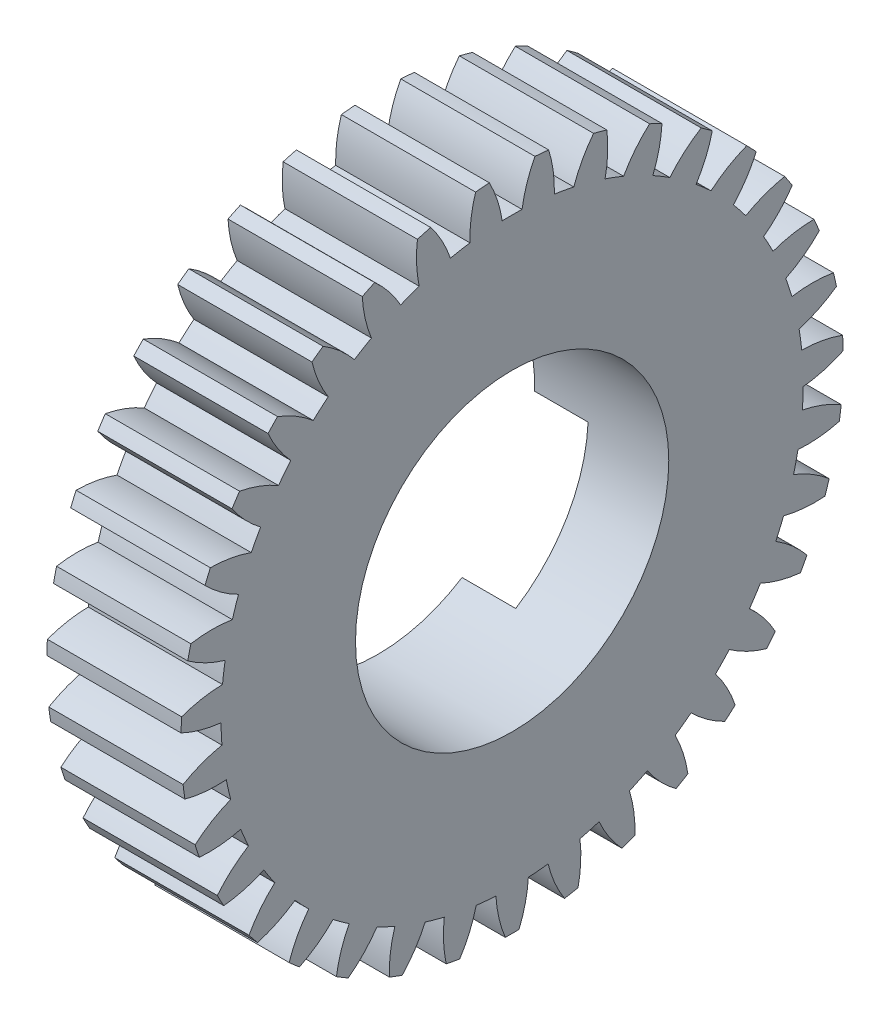
from build123d import *

# Parameters (mm, degrees)
SPUR_START             = -50.197682286
SPUR_GEAR_AI_OUTLINE_R = 11.1125
SPUR_GEAR_AI_DEPTH     = 9.525
CUT_EXTRUDE1_DEPTH     = 3.81
FILLET1_R              = 3.175


# Read off the part's stored shape, not the designer's step: spur gear_ai
with BuildPart() as part:
    # spur gear_ai outline → spur gear_ai (new body)
    with BuildSketch(Plane.YZ.offset(SPUR_START)):
        with BuildLine():
            ThreePointArc((32.465138514, 13.00952455), (32.599496942, 13.477405803), (32.724133068, 13.947970241))
            ThreePointArc((32.724133068, 13.947970241), (31.486680208, 14.75753637), (30.13215139, 15.350780486))
            ThreePointArc((30.13215139, 15.350780486), (30.269532321, 16.0407059), (30.383333924, 16.734910332))
            ThreePointArc((30.383333924, 16.734910332), (31.859942083, 16.814378835), (33.302949758, 17.137513095))
            ThreePointArc((33.302949758, 17.137513095), (33.351605568, 17.621865927), (33.390216215, 18.10712284))
            ThreePointArc((33.390216215, 18.10712284), (32.028096117, 18.682723168), (30.589407307, 19.024573147))
            ThreePointArc((30.589407307, 19.024573147), (30.60138953, 19.72794149), (30.589407307, 20.431309832))
            ThreePointArc((30.589407307, 20.431309832), (32.028096117, 20.773159811), (33.390216215, 21.348760139))
            ThreePointArc((33.390216215, 21.348760139), (33.351605568, 21.834017052), (33.302949758, 22.318369884))
            ThreePointArc((33.302949758, 22.318369884), (31.859942083, 22.641504144), (30.383333924, 22.720972647))
            ThreePointArc((30.383333924, 22.720972647), (30.269532321, 23.415177079), (30.13215139, 24.105102493))
            ThreePointArc((30.13215139, 24.105102493), (31.486680208, 24.698346609), (32.724133068, 25.507912738))
            ThreePointArc((32.724133068, 25.507912738), (32.599496942, 25.978477176), (32.465138514, 26.446358429))
            ThreePointArc((32.465138514, 26.446358429), (30.987622717, 26.506640818), (29.520554609, 26.321173662))
            ThreePointArc((29.520554609, 26.321173662), (29.284626856, 26.983901882), (29.026262754, 27.638209599))
            ThreePointArc((29.026262754, 27.638209599), (30.253095909, 28.463780497), (31.326108778, 29.481292306))
            ThreePointArc((31.326108778, 29.481292306), (31.119453082, 29.92203994), (30.903710425, 30.358411525))
            ThreePointArc((30.903710425, 30.358411525), (29.439175078, 30.153904518), (28.028799798, 29.70946277))
            ThreePointArc((28.028799798, 29.70946277), (27.678328808, 30.319414148), (27.307285569, 30.917074179))
            ThreePointArc((27.307285569, 30.917074179), (28.366991634, 31.948437332), (29.241076997, 33.141191153))
            ThreePointArc((29.241076997, 33.141191153), (28.959043813, 33.537955992), (28.668851074, 33.928792567))
            ThreePointArc((28.668851074, 33.928792567), (27.264367549, 33.466069188), (25.956015718, 32.776937571))
            ThreePointArc((25.956015718, 32.776937571), (25.502265918, 33.314507768), (25.030469177, 33.836310828))
            ThreePointArc((25.030469177, 33.836310828), (25.888988328, 35.040317375), (26.53605236, 36.36997712))
            ThreePointArc((26.53605236, 36.36997712), (26.187706468, 36.710006815), (25.832390681, 37.042746571))
            ThreePointArc((25.832390681, 37.042746571), (24.533100233, 36.33667913), (23.368823357, 35.425006901))
            ThreePointArc((23.368823357, 35.425006901), (22.826378637, 35.872917969), (22.268992329, 36.302092878))
            ThreePointArc((22.268992329, 36.302092878), (22.898731054, 37.640045058), (23.297976586, 39.063874368))
            ThreePointArc((23.297976586, 39.063874368), (22.89451411, 39.336240086), (22.485495416, 39.600188493))
            ThreePointArc((22.485495416, 39.600188493), (21.33315831, 38.673470579), (20.350377203, 37.568559634))
            ThreePointArc((20.350377203, 37.568559634), (19.736672184, 37.912415341), (19.111611165, 38.235168065))
            ThreePointArc((19.111611165, 38.235168065), (19.492329143, 39.664062994), (19.630924094, 41.136298824))
            ThreePointArc((19.630924094, 41.136298824), (19.185312649, 41.332246506), (18.735737246, 41.518920046))
            ThreePointArc((18.735737246, 41.518920046), (17.767390544, 40.401337134), (16.997692602, 39.13870022))
            ThreePointArc((16.997692602, 39.13870022), (16.332452268, 39.367448762), (15.659806512, 39.573405762))
            ThreePointArc((15.659806512, 39.573405762), (15.779267154, 41.047317582), (15.652756969, 42.520641061))
            ThreePointArc((15.652756969, 42.520641061), (15.179318873, 42.633872786), (14.703636484, 42.737271618))
            ThreePointArc((14.703636484, 42.737271618), (13.950403647, 41.464743743), (13.418527594, 40.084963049))
            ThreePointArc((13.418527594, 40.084963049), (12.723133316, 40.19125226), (12.024522212, 40.273793909))
            ThreePointArc((12.024522212, 40.273793909), (11.878885954, 41.745349881), (11.491336775, 43.172407179))
            ThreePointArc((11.491336775, 43.172407179), (11.00528872, 43.199283588), (10.518788168, 43.216084387))
            ThreePointArc((10.518788168, 43.216084387), (10.004878718, 41.829511643), (9.727919488, 40.376934456))
            ThreePointArc((9.727919488, 40.376934456), (9.024721811, 40.357348112), (8.322599294, 40.313821453))
            ThreePointArc((8.322599294, 40.313821453), (7.916547006, 41.735724557), (7.280414982, 43.07064888))
            ThreePointArc((7.280414982, 43.07064888), (6.79737895, 43.010306142), (6.315696764, 42.939968918))
            ThreePointArc((6.315696764, 42.939968918), (6.057628173, 41.483916892), (6.044487465, 40.005230238))
            ThreePointArc((6.044487465, 40.005230238), (5.35608774, 39.860397862), (4.673020606, 39.692201878))
            ThreePointArc((4.673020606, 39.692201878), (4.019603142, 41.018750978), (3.15533408, 42.218636759))
            ThreePointArc((3.15533408, 42.218636759), (2.690835248, 42.07301434), (2.229453088, 41.917799788))
            ThreePointArc((2.229453088, 41.917799788), (2.235519895, 40.439067191), (2.48662006, 38.981797276))
            ThreePointArc((2.48662006, 38.981797276), (1.835144022, 38.716373898), (1.19308661, 38.428914547))
            ThreePointArc((1.19308661, 38.428914547), (0.313305346, 39.617473264), (-0.751322437, 40.643755186))
            ThreePointArc((-0.751322437, 40.643755186), (-1.182354694, 40.41753351), (-1.608607624, 40.182430355))
            ThreePointArc((-1.608607624, 40.182430355), (-1.338600413, 38.72854487), (-0.83132994, 37.339529547))
            ThreePointArc((-0.83132994, 37.339529547), (-1.424943316, 36.962046093), (-2.005354751, 36.564562554))
            ThreePointArc((-2.005354751, 36.564562554), (-3.083222923, 37.576929633), (-4.313991412, 38.396622152))
            ThreePointArc((-4.313991412, 38.396622152), (-4.697703364, 38.09707217), (-5.075126945, 37.789636819))
            ThreePointArc((-5.075126945, 37.789636819), (-4.549857583, 36.407327521), (-3.802720892, 35.131210887))
            ThreePointArc((-3.802720892, 35.131210887), (-4.319392384, 34.653799986), (-4.819502942, 34.159067708))
            ThreePointArc((-4.819502942, 34.159067708), (-6.060814451, 34.962704838), (-7.418165735, 35.54946236))
            ThreePointArc((-7.418165735, 35.54946236), (-7.742224563, 35.186211855), (-8.05868809, 34.816325535))
            ThreePointArc((-8.05868809, 34.816325535), (-7.295039167, 33.550020982), (-6.332049847, 32.427818474))
            ThreePointArc((-6.332049847, 32.427818474), (-6.755173207, 31.865824506), (-7.158908923, 31.28974459))
            ThreePointArc((-7.158908923, 31.28974459), (-8.523766996, 31.858822213), (-9.964074688, 32.19378587))
            ThreePointArc((-9.964074688, 32.19378587), (-10.218064875, 31.778510012), (-10.46339695, 31.358061172))
            ThreePointArc((-10.46339695, 31.358061172), (-9.48591277, 30.248461435), (-8.33802209, 29.316241566))
            ThreePointArc((-8.33802209, 29.316241566), (-8.653997786, 28.687727479), (-8.948382262, 28.048815608))
            ThreePointArc((-8.948382262, 28.048815608), (-10.392919237, 28.3650431), (-11.869890662, 28.437446885))
            ThreePointArc((-11.869890662, 28.437446885), (-12.045648755, 27.983492981), (-12.211964203, 27.525995194))
            ThreePointArc((-12.211964203, 27.525995194), (-11.052061913, 26.608763721), (-9.756164023, 25.896488804))
            ThreePointArc((-9.756164023, 25.896488804), (-9.954836336, 25.221655558), (-10.130407813, 24.540446886))
            ThreePointArc((-10.130407813, 24.540446886), (-11.608195083, 24.593660435), (-13.074359165, 24.40117723))
            ThreePointArc((-13.074359165, 24.40117723), (-13.166236154, 23.923135733), (-13.24818946, 23.443293353))
            ThreePointArc((-13.24818946, 23.443293353), (-11.943149273, 22.747910718), (-10.540895397, 22.278473856))
            ThreePointArc((-10.540895397, 22.278473856), (-10.615878835, 21.579011146), (-10.666994302, 20.87740028))
            ThreePointArc((-10.666994302, 20.87740028), (-12.130534569, 20.665889559), (-13.538767587, 20.214705933))
            ThreePointArc((-13.538767587, 20.214705933), (-13.54381047, 19.72794149), (-13.538767587, 19.241177046))
            ThreePointArc((-13.538767587, 19.241177046), (-12.130534569, 18.78999342), (-10.666994302, 18.578482699))
            ThreePointArc((-10.666994302, 18.578482699), (-10.615878835, 17.876871833), (-10.540895397, 17.177409123))
            ThreePointArc((-10.540895397, 17.177409123), (-11.943149273, 16.707972261), (-13.24818946, 16.012589626))
            ThreePointArc((-13.24818946, 16.012589626), (-13.166236154, 15.532747246), (-13.074359165, 15.054705749))
            ThreePointArc((-13.074359165, 15.054705749), (-11.608195083, 14.862222544), (-10.130407813, 14.915436093))
            ThreePointArc((-10.130407813, 14.915436093), (-9.954836336, 14.234227421), (-9.756164023, 13.559394175))
            ThreePointArc((-9.756164023, 13.559394175), (-11.052061913, 12.847119258), (-12.211964203, 11.929887785))
            ThreePointArc((-12.211964203, 11.929887785), (-12.045648755, 11.472389998), (-11.869890662, 11.018436094))
            ThreePointArc((-11.869890662, 11.018436094), (-10.392919237, 11.090839879), (-8.948382262, 11.40706737))
            ThreePointArc((-8.948382262, 11.40706737), (-8.653997786, 10.7681555), (-8.33802209, 10.139641413))
            ThreePointArc((-8.33802209, 10.139641413), (-9.48591277, 9.207421544), (-10.46339695, 8.097821807))
            ThreePointArc((-10.46339695, 8.097821807), (-10.218064875, 7.677372967), (-9.964074688, 7.262097109))
            ThreePointArc((-9.964074688, 7.262097109), (-8.523766996, 7.597060766), (-7.158908923, 8.166138388))
            ThreePointArc((-7.158908923, 8.166138388), (-6.755173207, 7.590058472), (-6.332049847, 7.028064504))
            ThreePointArc((-6.332049847, 7.028064504), (-7.295039167, 5.905861997), (-8.05868809, 4.639557444))
            ThreePointArc((-8.05868809, 4.639557444), (-7.742224563, 4.269671124), (-7.418165735, 3.906420618))
            ThreePointArc((-7.418165735, 3.906420618), (-6.060814451, 4.493178141), (-4.819502942, 5.296815271))
            ThreePointArc((-4.819502942, 5.296815271), (-4.319392384, 4.802082992), (-3.802720892, 4.324672092))
            ThreePointArc((-3.802720892, 4.324672092), (-4.549857583, 3.048555458), (-5.075126945, 1.666246159))
            ThreePointArc((-5.075126945, 1.666246159), (-4.697703364, 1.358810809), (-4.313991412, 1.059260827))
            ThreePointArc((-4.313991412, 1.059260827), (-3.083222923, 1.878953346), (-2.005354751, 2.891320425))
            ThreePointArc((-2.005354751, 2.891320425), (-1.424943316, 2.493836885), (-0.83132994, 2.116353432))
            ThreePointArc((-0.83132994, 2.116353432), (-1.338600413, 0.727338109), (-1.608607624, -0.726547376))
            ThreePointArc((-1.608607624, -0.726547376), (-1.182354695, -0.961650532), (-0.751322437, -1.187872207))
            ThreePointArc((-0.751322437, -1.187872207), (0.313305346, -0.161590285), (1.19308661, 1.026968432))
            ThreePointArc((1.19308661, 1.026968432), (1.835144022, 0.739509081), (2.48662006, 0.474085703))
            ThreePointArc((2.48662006, 0.474085703), (2.235519895, -0.983184212), (2.229453088, -2.461916809))
            ThreePointArc((2.229453088, -2.461916809), (2.690835248, -2.617131361), (3.15533408, -2.76275378))
            ThreePointArc((3.15533408, -2.76275378), (4.019603142, -1.562867999), (4.673020606, -0.236318899))
            ThreePointArc((4.673020606, -0.236318899), (5.35608774, -0.404514883), (6.044487465, -0.54934726))
            ThreePointArc((6.044487465, -0.54934726), (6.057628173, -2.028033914), (6.315696764, -3.484085939))
            ThreePointArc((6.315696764, -3.484085939), (6.79737895, -3.554423163), (7.280414982, -3.614765901))
            ThreePointArc((7.280414982, -3.614765901), (7.916547006, -2.279841578), (8.322599294, -0.857938474))
            ThreePointArc((8.322599294, -0.857938474), (9.024721811, -0.901465133), (9.727919488, -0.921051477))
            ThreePointArc((9.727919488, -0.921051477), (10.004878718, -2.373628664), (10.518788168, -3.760201408))
            ThreePointArc((10.518788168, -3.760201408), (11.00528872, -3.743400609), (11.491336775, -3.7165242))
            ThreePointArc((11.491336775, -3.7165242), (11.878885954, -2.289466902), (12.024522212, -0.81791093))
            ThreePointArc((12.024522212, -0.81791093), (12.723133316, -0.735369281), (13.418527594, -0.62908007))
            ThreePointArc((13.418527594, -0.62908007), (13.950403647, -2.008860764), (14.703636484, -3.281388639))
            ThreePointArc((14.703636484, -3.281388639), (15.179318873, -3.177989807), (15.652756969, -3.064758082))
            ThreePointArc((15.652756969, -3.064758082), (15.779267154, -1.591434603), (15.659806512, -0.117522783))
            ThreePointArc((15.659806512, -0.117522783), (16.332452268, 0.088434217), (16.997692602, 0.317182759))
            ThreePointArc((16.997692602, 0.317182759), (17.767390544, -0.945454155), (18.735737246, -2.063037067))
            ThreePointArc((18.735737246, -2.063037067), (19.185312649, -1.876363527), (19.630924094, -1.680415845))
            ThreePointArc((19.630924094, -1.680415845), (19.492329143, -0.208180015), (19.111611165, 1.220714914))
            ThreePointArc((19.111611165, 1.220714914), (19.736672184, 1.543467638), (20.350377203, 1.887323345))
            ThreePointArc((20.350377203, 1.887323345), (21.33315831, 0.7824124), (22.485495416, -0.144305514))
            ThreePointArc((22.485495416, -0.144305514), (22.89451411, 0.119642893), (23.297976586, 0.392008611))
            ThreePointArc((23.297976586, 0.392008611), (22.898731054, 1.815837921), (22.268992329, 3.153790101))
            ThreePointArc((22.268992329, 3.153790101), (22.826378637, 3.58296501), (23.368823357, 4.030876078))
            ThreePointArc((23.368823357, 4.030876078), (24.533100233, 3.119203849), (25.832390681, 2.413136408))
            ThreePointArc((25.832390681, 2.413136408), (26.187706468, 2.745876164), (26.53605236, 3.085905859))
            ThreePointArc((26.53605236, 3.085905859), (25.888988328, 4.415565604), (25.030469177, 5.619572151))
            ThreePointArc((25.030469177, 5.619572151), (25.502265918, 6.141375211), (25.956015718, 6.678945408))
            ThreePointArc((25.956015718, 6.678945408), (27.264367549, 5.989813791), (28.668851074, 5.527090412))
            ThreePointArc((28.668851074, 5.527090412), (28.959043813, 5.917926987), (29.241076997, 6.314691826))
            ThreePointArc((29.241076997, 6.314691826), (28.366991634, 7.507445647), (27.307285569, 8.5388088))
            ThreePointArc((27.307285569, 8.5388088), (27.678328808, 9.136468831), (28.028799798, 9.746420209))
            ThreePointArc((28.028799798, 9.746420209), (29.439175078, 9.301978461), (30.903710425, 9.097471454))
            ThreePointArc((30.903710425, 9.097471454), (31.119453082, 9.533843039), (31.326108778, 9.974590673))
            ThreePointArc((31.326108778, 9.974590673), (30.253095909, 10.992102482), (29.026262754, 11.81767338))
            ThreePointArc((29.026262754, 11.81767338), (29.284626856, 12.471981097), (29.520554609, 13.134709317))
            ThreePointArc((29.520554609, 13.134709317), (30.987622717, 12.949242161), (32.465138514, 13.00952455))
        make_face()
        with Locations((9.95118953, 19.727941489)):
            Circle(SPUR_GEAR_AI_OUTLINE_R, mode=Mode.SUBTRACT)
    extrude(amount=SPUR_GEAR_AI_DEPTH)

    # Sketch1 → Cut-Extrude1 (cut)
    with BuildSketch(Plane.ZY.offset(50.197682286)):
        with BuildLine():
            Line((11.496022214, 25.764559329), (14.596760025, 19.808097414))
            ThreePointArc((14.596760025, 19.808097414), (19.727941489, 21.06368953), (24.859122954, 19.808097414))
            Line((24.859122954, 19.808097414), (27.959860765, 25.764559329))
            ThreePointArc((27.959860765, 25.764559329), (28.301922821, 26.288224178), (28.740009033, 26.734667674))
            ThreePointArc((28.740009033, 26.734667674), (19.727941489, 29.00118953), (10.715873946, 26.734667674))
            ThreePointArc((10.715873946, 26.734667674), (11.153960157, 26.288224178), (11.496022214, 25.764559329))
        make_face()
        with BuildLine():
            Line((37.538681093, 9.173555845), (30.829864852, 9.466469088))
            ThreePointArc((30.829864852, 9.466469088), (29.351648789, 4.39493953), (25.698683387, 0.579002089))
            Line((25.698683387, 0.579002089), (29.306761817, -5.084546584))
            ThreePointArc((29.306761817, -5.084546584), (29.589237851, -5.642613438), (29.756826154, -6.245228975))
            ThreePointArc((29.756826154, -6.245228975), (36.225725432, 0.42618953), (38.768893697, 9.364129892))
            ThreePointArc((38.768893697, 9.364129892), (38.163219183, 9.207957852), (37.538681093, 9.173555845))
        make_face()
        with BuildLine():
            ThreePointArc((13.757199592, 0.579002089), (10.10423419, 4.39493953), (8.626018127, 9.466469088))
            Line((8.626018127, 9.466469088), (1.917201886, 9.173555845))
            ThreePointArc((1.917201886, 9.173555845), (1.292663796, 9.207957852), (0.686989282, 9.364129892))
            ThreePointArc((0.686989282, 9.364129892), (3.230157547, 0.42618953), (9.699056825, -6.245228975))
            ThreePointArc((9.699056825, -6.245228975), (9.866645128, -5.642613438), (10.149121162, -5.084546584))
            Line((10.149121162, -5.084546584), (13.757199592, 0.579002089))
        make_face()
    extrude(amount=-CUT_EXTRUDE1_DEPTH, mode=Mode.SUBTRACT)

    # Fillet1
    fillet1_edges = [part.edges().sort_by_distance(p)[0] for p in [
        (-48.292682286, -6.245228975, 9.699056825),
        (-48.292682286, 9.364129892, 0.686989282),
        (-48.292682286, -6.245228975, 29.756826154),
        (-48.292682286, 9.364129892, 38.768893697),
        (-48.292682286, 26.734667674, 28.740009033),
        (-48.292682286, 26.734667674, 10.715873946),
    ]]
    fillet(fillet1_edges, radius=FILLET1_R)


solid = part.part
